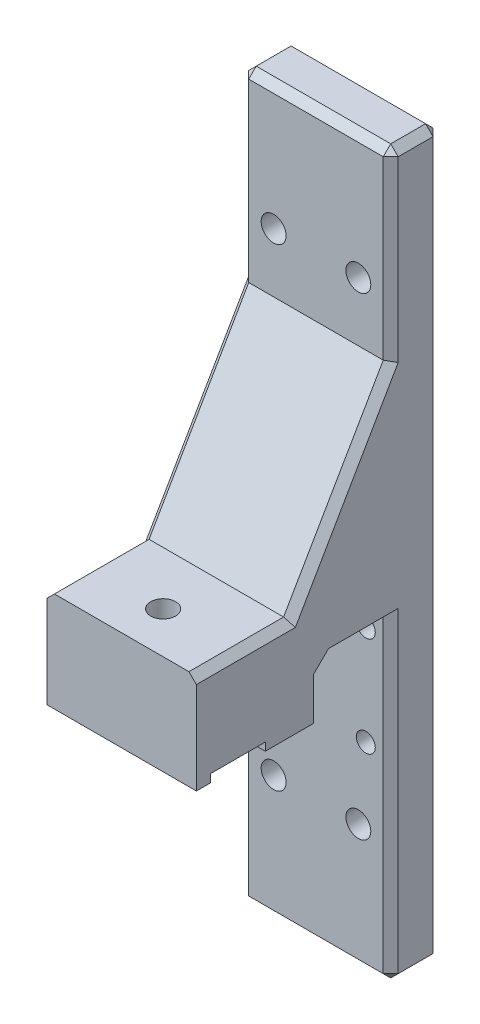
from build123d import *

# Parameters (mm, degrees)
SKETCH1_W           = 30
SKETCH1_H           = 145
BOSS_EXTRUDE1_DEPTH = 10
CUT_EXTRUDE1_DEPTH  = 32
CUT_EXTRUDE2_DEPTH  = 32
SKETCH4_R           = 3.5
CUT_EXTRUDE3_DEPTH  = 5
SKETCH5_W           = 30
SKETCH5_H           = 10
BOSS_EXTRUDE2_DEPTH = 39
SKETCH6_W           = 30
SKETCH6_H           = 25
BOSS_EXTRUDE3_DEPTH = 10
SKETCH7_W           = 11
SKETCH7_H           = 1.6
CUT_EXTRUDE4_DEPTH  = 61
SKETCH8_R           = 2.5
CUT_EXTRUDE5_DEPTH  = 61
CHAMFER1_SIZE       = 20
CHAMFER1_SIZE2      = 34.641016151
CHAMFER2_SIZE       = 1.5


with BuildPart() as part:
    # Sketch1 → Boss-Extrude1 (new body)
    with BuildSketch(Plane.XY):
        with Locations((15, 72.5)):
            Rectangle(SKETCH1_W, SKETCH1_H)
    extrude(amount=BOSS_EXTRUDE1_DEPTH)

    # Sketch2 → Cut-Extrude1 (cut)
    with BuildSketch(Plane.XY.offset(10)):
        with BuildLine():
            Line((6.5, 117.5), (6.5, 120))
            Line((6.5, 120), (9, 120))
            ThreePointArc((9, 120), (4.732233047, 121.767766953), (6.5, 117.5))
        make_face()
        with BuildLine():
            Line((9, 120), (6.5, 120))
            Line((6.5, 120), (6.5, 117.5))
            ThreePointArc((6.5, 117.5), (8.267766953, 118.232233047), (9, 120))
        make_face()
        with BuildLine():
            ThreePointArc((26, 120), (23.5, 122.5), (21, 120))
            Line((21, 120), (23.5, 120))
            Line((23.5, 120), (23.5, 117.5))
            ThreePointArc((23.5, 117.5), (25.267766953, 118.232233047), (26, 120))
        make_face()
        with BuildLine():
            Line((23.5, 120), (21, 120))
            ThreePointArc((21, 120), (21.732233047, 118.232233047), (23.5, 117.5))
            Line((23.5, 117.5), (23.5, 120))
        make_face()
        with BuildLine():
            ThreePointArc((26, 25), (25.267766953, 26.767766953), (23.5, 27.5))
            Line((23.5, 27.5), (23.5, 25))
            Line((23.5, 25), (21, 25))
            ThreePointArc((21, 25), (23.5, 22.5), (26, 25))
        make_face()
        with BuildLine():
            Line((23.5, 25), (23.5, 27.5))
            ThreePointArc((23.5, 27.5), (21.732233047, 26.767766953), (21, 25))
            Line((21, 25), (23.5, 25))
        make_face()
        with BuildLine():
            ThreePointArc((9, 25), (8.267766953, 26.767766953), (6.5, 27.5))
            Line((6.5, 27.5), (6.5, 25))
            Line((6.5, 25), (9, 25))
        make_face()
        with BuildLine():
            Line((6.5, 25), (6.5, 27.5))
            ThreePointArc((6.5, 27.5), (4.732233047, 23.232233047), (9, 25))
            Line((9, 25), (6.5, 25))
        make_face()
    extrude(amount=-CUT_EXTRUDE1_DEPTH, mode=Mode.SUBTRACT)

    # Sketch3 → Cut-Extrude2 (cut)
    with BuildSketch(Plane.XY.offset(10)):
        with BuildLine():
            ThreePointArc((6.9, 60), (3.656497116, 61.343502884), (5, 58.1))
            Line((5, 58.1), (5, 60))
            Line((5, 60), (6.9, 60))
        make_face()
        with BuildLine():
            Line((5, 60), (5, 58.1))
            ThreePointArc((5, 58.1), (6.343502884, 58.656497116), (6.9, 60))
            Line((6.9, 60), (5, 60))
        make_face()
        with BuildLine():
            ThreePointArc((23.1, 60), (23.656497116, 58.656497116), (25, 58.1))
            Line((25, 58.1), (25, 60))
            Line((25, 60), (23.1, 60))
        make_face()
        with BuildLine():
            Line((25, 60), (25, 58.1))
            ThreePointArc((25, 58.1), (26.343502884, 58.656497116), (26.9, 60))
            ThreePointArc((26.9, 60), (25, 61.9), (23.1, 60))
            Line((23.1, 60), (25, 60))
        make_face()
        with BuildLine():
            Line((5, 41.9), (5, 40))
            Line((5, 40), (6.9, 40))
            ThreePointArc((6.9, 40), (6.343502884, 41.343502884), (5, 41.9))
        make_face()
        with BuildLine():
            Line((6.9, 40), (5, 40))
            Line((5, 40), (5, 41.9))
            ThreePointArc((5, 41.9), (3.656497116, 38.656497116), (6.9, 40))
        make_face()
        with BuildLine():
            ThreePointArc((25, 41.9), (23.656497116, 41.343502884), (23.1, 40))
            Line((23.1, 40), (25, 40))
            Line((25, 40), (25, 41.9))
        make_face()
        with BuildLine():
            Line((25, 40), (23.1, 40))
            ThreePointArc((23.1, 40), (25, 38.1), (26.9, 40))
            ThreePointArc((26.9, 40), (26.343502884, 41.343502884), (25, 41.9))
            Line((25, 41.9), (25, 40))
        make_face()
    extrude(amount=-CUT_EXTRUDE2_DEPTH, mode=Mode.SUBTRACT)

    # Sketch4 → Cut-Extrude3 (cut)
    with BuildSketch(Plane(origin=(0, 0, 0), x_dir=(-1, 0, 0), z_dir=(0, 0, -1))):
        with Locations((-5, 60)):
            Circle(SKETCH4_R)
        with Locations((-5, 40)):
            Circle(SKETCH4_R)
        with Locations((-25, 40)):
            Circle(SKETCH4_R)
        with Locations((-25, 60)):
            Circle(SKETCH4_R)
    extrude(amount=-CUT_EXTRUDE3_DEPTH, mode=Mode.SUBTRACT)

    # Sketch5 → Boss-Extrude2 (add)
    with BuildSketch(Plane.XY.offset(10)):
        with Locations((15, 68.5)):
            Rectangle(SKETCH5_W, SKETCH5_H)
    extrude(amount=BOSS_EXTRUDE2_DEPTH)

    # Sketch6 → Boss-Extrude3 (add)
    with BuildSketch(Plane.XZ.offset(-63.5)):
        with Locations((15, 36.5)):
            Rectangle(SKETCH6_W, SKETCH6_H)
    extrude(amount=BOSS_EXTRUDE3_DEPTH)

    # Sketch7 → Cut-Extrude4 (cut)
    with BuildSketch(Plane(origin=(30, 0, 0), x_dir=(0, 0, -1), z_dir=(1, 0, 0))):
        with Locations((-40.675105606, 54.3)):
            Rectangle(SKETCH7_W, SKETCH7_H)
    extrude(amount=-CUT_EXTRUDE4_DEPTH, mode=Mode.SUBTRACT)

    # Sketch8 → Cut-Extrude5 (cut)
    with BuildSketch(Plane.XZ.offset(-55.1)):
        with Locations(Location((15, 40.675105606, 0), (0, 0, 270))):
            Circle(SKETCH8_R)
    extrude(amount=-CUT_EXTRUDE5_DEPTH, mode=Mode.SUBTRACT)

    # Chamfer1
    chamfer1_edges = [part.edges().sort_by_distance(p)[0] for p in [
        (15, 73.5, 10),
    ]]
    chamfer1_side = [part.faces().sort_by_distance(p)[0] for p in [
        (15, 73.5, 29.309258212),
    ]]
    chamfer(chamfer1_edges, length=CHAMFER1_SIZE, length2=CHAMFER1_SIZE2, reference=chamfer1_side[0])

    # Chamfer2
    chamfer2_edges = [part.edges().sort_by_distance(p)[0] for p in [
        (30, 63.5, 17),
        (0, 63.5, 17),
        (15, 63.5, 24),
        (0, 58.5, 24),
        (30, 58.5, 24),
        (15, 53.5, 24),
        (30, 31.75, 10),
        (30, 126.570508076, 10),
        (0, 90.820508076, 20),
        (30, 90.820508076, 20),
        (15, 145, 10),
        (0, 126.570508076, 10),
        (15, 145, 0),
        (30, 72.5, 0),
        (15, 0, 0),
        (0, 72.5, 0),
        (0, 145, 5),
        (30, 145, 5),
        (30, 0, 5),
        (0, 0, 5),
        (15, 0, 10),
        (0, 31.75, 10),
        (0, 73.5, 39.5),
        (30, 73.5, 39.5),
    ]]
    chamfer(chamfer2_edges, length=CHAMFER2_SIZE - 0.0001)  # a hair under: the kernel refuses the full size


solid = part.part
